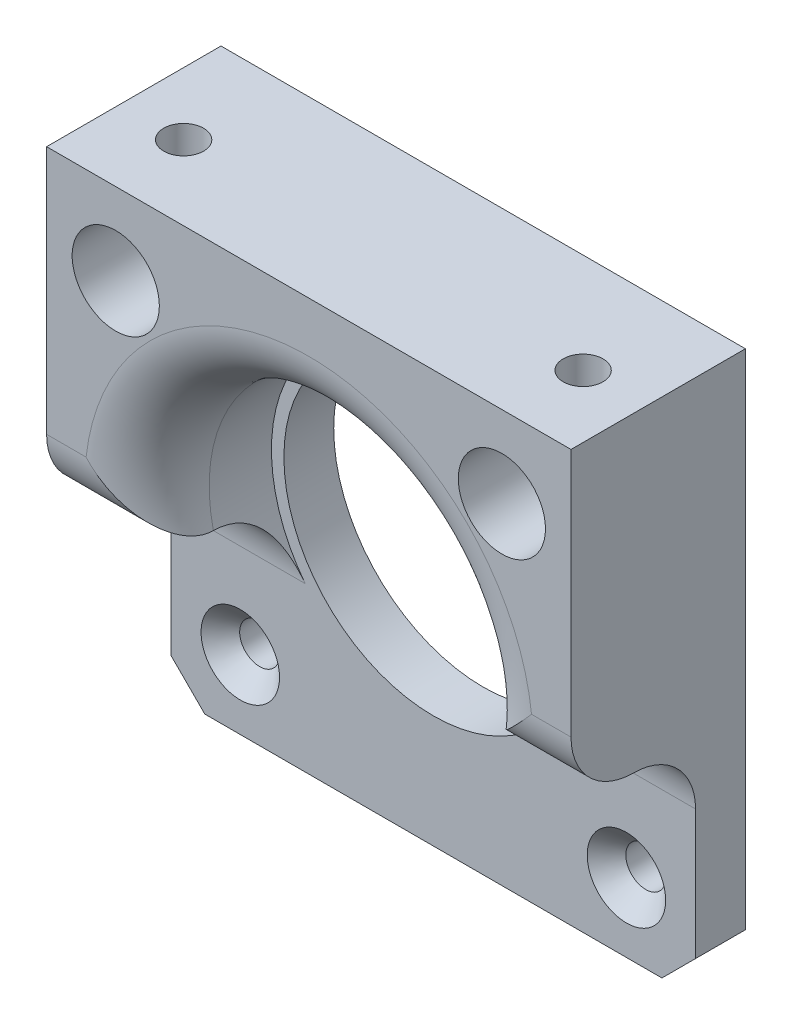
from build123d import *

# Parameters (mm, degrees)
ESBO_O1_W                                            = 42.10000000000001
ESBO_O1_H                                            = 42.10000000000002
RESSALTO_EXTRUS_O1_DEPTH                             = 4
ESBO_O2_R                                            = 12.000000000000007
CORTE_EXTRUS_O1_DEPTH                                = 8
ESCAREADO_PARA_PARAFUSO_DE_M_QUINA_COM_C_D           = 3.2
ESCAREADO_PARA_PARAFUSO_DE_M_QUINA_COM_C_CSINK_D     = 6.3
ESCAREADO_PARA_PARAFUSO_DE_M_QUINA_COM_C_CSINK_ANGLE = 90
RESSALTO_EXTRUS_O2_DEPTH                             = 10
ESBO_O6_R                                            = 3.5000000000000075
CORTE_EXTRUS_O2_DEPTH                                = 10.000000000000002
FURO_COM_FOLGA_DE_M31_D                              = 3.2
FILETE1_R                                            = 5
CORTE_EXTRUS_O6_DEPTH                                = 22.500000000000007
CHANFRO1_SIZE                                        = 2.7
SKETCH2_W                                            = 42.10000000000001
SKETCH2_H                                            = 14.000000000000002
SKETCH2_R                                            = 1.5999999999999908
BOSS_EXTRUDE1_DEPTH                                  = 1


with BuildPart() as part:
    # Esboço1 → Ressalto-extrusão1 (new body)
    with BuildSketch(Plane.XY):
        with Locations((87.32270610713223, -330.71568115646056)):
            Rectangle(ESBO_O1_W, ESBO_O1_H)
    extrude(amount=RESSALTO_EXTRUS_O1_DEPTH)

    # Esboço2 → Corte-extrusão1 (cut)
    with BuildSketch(Plane.XY.offset(4)):
        with Locations((87.32270610713225, -330.71568115646056)):
            Circle(ESBO_O2_R)
    extrude(amount=-CORTE_EXTRUS_O1_DEPTH, mode=Mode.SUBTRACT)

    # Escareado para parafuso de máquina com cabeça chata de M31 (through all)
    with Locations(Plane.XY.offset(4)):
        with Locations((102.822706107, -346.215681156), (102.822706107, -315.215681156), (71.822706107, -315.215681156), (71.822706107, -346.215681156)):
            CounterSinkHole(ESCAREADO_PARA_PARAFUSO_DE_M_QUINA_COM_C_D / 2, ESCAREADO_PARA_PARAFUSO_DE_M_QUINA_COM_C_CSINK_D / 2, counter_sink_angle=ESCAREADO_PARA_PARAFUSO_DE_M_QUINA_COM_C_CSINK_ANGLE)

    # Esboço5 → Ressalto-extrusão2 (add)
    with BuildSketch(Plane.XY.offset(4)):
        with BuildLine():
            Line((99.98357100649832, -333.66568115646055), (108.37270610713225, -333.66568115646055))
            Line((108.37270610713225, -333.66568115646055), (108.37270610713225, -309.66568115646055))
            Line((108.37270610713225, -309.66568115646055), (66.27270610713224, -309.66568115646055))
            Line((66.27270610713224, -309.66568115646055), (66.27270610713224, -333.66568115646055))
            Line((66.27270610713224, -333.66568115646055), (74.66184120776617, -333.66568115646055))
            ThreePointArc((74.66184120776617, -333.66568115646055), (87.32270610713225, -317.71568115646056), (99.98357100649832, -333.66568115646055))
        make_face()
    extrude(amount=RESSALTO_EXTRUS_O2_DEPTH)

    # Esboço6 → Corte-extrusão2 (cut)
    with BuildSketch(Plane.XY.offset(14)):
        with Locations((71.82270610713223, -315.21568115646056)):
            Circle(ESBO_O6_R)
        with Locations((102.82270610713226, -315.21568115646056)):
            Circle(ESBO_O6_R)
    extrude(amount=-CORTE_EXTRUS_O2_DEPTH, mode=Mode.SUBTRACT)

    # Furo com folga de M31 (through all)
    with Locations(Plane(origin=(0, -309.66568115646055, 0), x_dir=(1, 0, 0), z_dir=(0, 1, 0))):
        with Locations((103.359135837, -8.012655369), (71.286276377, -8.012655369)):
            Hole(FURO_COM_FOLGA_DE_M31_D / 2)

    # Filete1
    # the kernel refuses this fillet: 5 mm, written as the material it adds along each edge
    with BuildSketch(Plane(origin=(87.48357100649832, -333.66568115646055, 4), x_dir=(0, -1, 0), z_dir=(1, 0, 0))) as filete1_piece_1_section:
        with BuildLine():
            CenterArc((FILETE1_R, -FILETE1_R), FILETE1_R, 90, 90)
            Line((0, -FILETE1_R), (0, 0))
            Line((0, 0), (FILETE1_R, 0))
        make_face()
    filete1_piece_1 = extrude(amount=20.889135100633922, mode=Mode.PRIVATE)
    filete1_piece_1 = filete1_piece_1 - Plane(origin=(87.32270610713225, -330.71568115646056, 5.015859225762799), x_dir=(-0.9739126845666216, -0.22692307692307614, 0), z_dir=(0, 0, -1)) * Cylinder(12.999999999999995, 62, mode=Mode.PRIVATE)
    filete1_piece_1 = filete1_piece_1 - Plane(origin=(103.359135837, -334.8905504329836, 8.012655369), x_dir=(-1, 0, 0), z_dir=(0, -1, 0)) * Cylinder(1.6, 62, mode=Mode.PRIVATE)
    add(filete1_piece_1)
    with BuildSketch(Plane(origin=(66.27270610713224, -333.66568115646055, 4), x_dir=(0, -1, 0), z_dir=(1, 0, 0))) as filete1_piece_2_section:
        with BuildLine():
            CenterArc((FILETE1_R, -FILETE1_R), FILETE1_R, 90, 90)
            Line((0, -FILETE1_R), (0, 0))
            Line((0, 0), (FILETE1_R, 0))
        make_face()
    filete1_piece_2 = extrude(amount=20.889135100633936, mode=Mode.PRIVATE)
    filete1_piece_2 = filete1_piece_2 - Plane(origin=(87.32270610713225, -330.71568115646056, 5.01585849038902), x_dir=(-0.9739126845666216, -0.22692307692307614, 0), z_dir=(0, 0, -1)) * Cylinder(12.999999999999995, 62, mode=Mode.PRIVATE)
    filete1_piece_2 = filete1_piece_2 - Plane(origin=(71.286276377, -334.8905494522985, 8.012655369), x_dir=(-1, 0, 0), z_dir=(0, -1, 0)) * Cylinder(1.6, 62, mode=Mode.PRIVATE)
    add(filete1_piece_2)
    # the kernel refuses this fillet: 5 mm, written as the material it takes off along each edge
    with BuildSketch(Plane(origin=(87.32270610713225, -330.71568115646056, 14), x_dir=(-0.36935058707522056, -0.9292901289840487, 0), z_dir=(0.9292901289840487, -0.36935058707522056, 0))) as filete1_2_piece_1:
        with BuildLine():
            CenterArc((12.999999999999979 + FILETE1_R, FILETE1_R), FILETE1_R, 180, 90)
            Line((12.999999999999979 + FILETE1_R, 0), (12.999999999999979, 0))
            Line((12.999999999999979, 0), (12.999999999999984, FILETE1_R))
        make_face()
    revolve(axis=Axis((87.32270610713225, -330.71568115646056, 14), (0, 0, -1)), revolution_arc=316.648856226302, mode=Mode.SUBTRACT)
    with BuildSketch(Plane(origin=(87.48357100649832, -333.66568115646055, 14), x_dir=(0, 0, -1), z_dir=(1, 0, 0))) as filete1_2_piece_2:
        with BuildLine():
            CenterArc((FILETE1_R, FILETE1_R), FILETE1_R, 180, 90)
            Line((0, FILETE1_R), (0, 0))
            Line((0, 0), (FILETE1_R, 0))
        make_face()
    extrude(amount=33.38913510063392, mode=Mode.SUBTRACT)
    with BuildSketch(Plane(origin=(53.77270610713224, -333.66568115646055, 14), x_dir=(0, 1, 0), z_dir=(1, 0, 0))) as filete1_2_piece_3:
        with BuildLine():
            CenterArc((FILETE1_R, -FILETE1_R), FILETE1_R, 90, 90)
            Line((0, -FILETE1_R), (0, 0))
            Line((0, 0), (FILETE1_R, 0))
        make_face()
    extrude(amount=33.389135100633936, mode=Mode.SUBTRACT)

    # Esboço13 → Corte-extrusão6 (cut)
    with BuildSketch(Plane.XZ.offset(351.7656811564606)):
        Polygon((74.0362763774125, 9.60036860941331), (71.28627637741243, 11.188081849684735), (68.53627637741243, 9.600368609413174), (68.53627637741253, 6.424942128870199), (71.2862763774126, 4.837228888598795), (74.03627637741259, 6.424942128870374), align=None)
        Polygon((106.10913583685199, 9.600368609413255), (103.35913583685196, 11.188081849684727), (100.60913583685196, 9.600368609413236), (100.60913583685199, 6.424942128870286), (103.359135836852, 4.837228888598834), (106.109135836852, 6.424942128870341), align=None)
    extrude(amount=-CORTE_EXTRUS_O6_DEPTH, mode=Mode.SUBTRACT)

    # Chanfro1
    chanfro1_edges = [part.edges().sort_by_distance(p)[0] for p in [
        (66.27270610713224, -351.7656811564606, 2),
        (108.37270610713225, -351.7656811564606, 2),
    ]]
    chamfer(chanfro1_edges, length=CHANFRO1_SIZE)

    # Sketch2 → Boss-Extrude1 (add)
    with BuildSketch(Plane(origin=(0, -309.66568115646055, 0), x_dir=(1, 0, 0), z_dir=(0, 1, 0))):
        with Locations((87.32270610713223, -7.000000000000001)):
            Rectangle(SKETCH2_W, SKETCH2_H)
        with Locations(Location((71.2862763774125, -8.012655369141836, 0), (0, 0, 270))):
            Circle(SKETCH2_R, mode=Mode.SUBTRACT)
        with Locations(Location((103.35913583685199, -8.012655369141836, 0), (0, 0, 270))):
            Circle(SKETCH2_R, mode=Mode.SUBTRACT)
    extrude(amount=BOSS_EXTRUDE1_DEPTH)


solid = part.part
